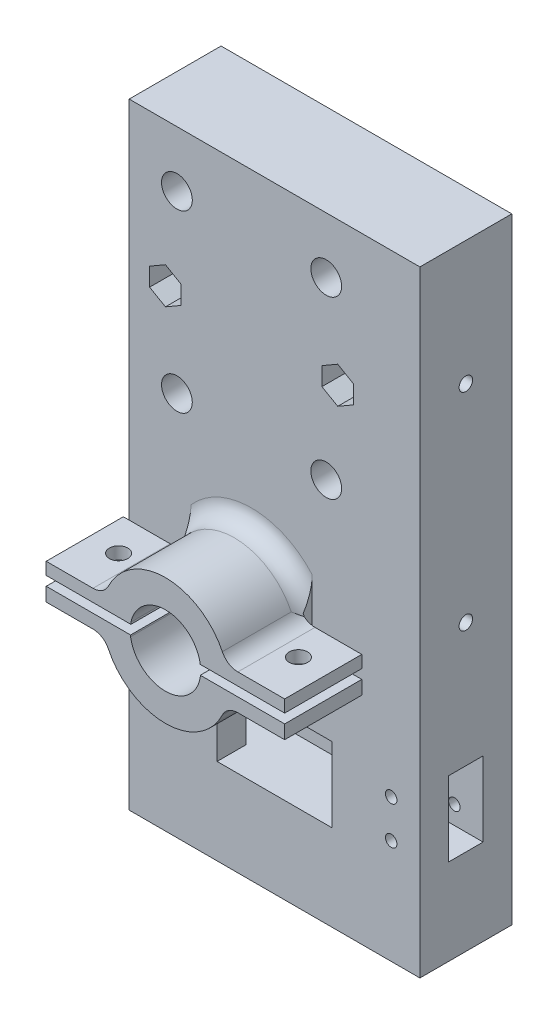
from build123d import *

# Parameters (mm, degrees)
SKETCH1_W               = 42.62295082
SKETCH1_H               = 50
SKETCH1_R               = 2.677018134
BOSS_EXTRUDE1_DEPTH     = 16
SKETCH2_R               = 11.04
CUT_EXTRUDE2_DEPTH      = 11
SKETCH3_R               = 1.75
CUT_EXTRUDE3_DEPTH      = 10
CUT_EXTRUDE6_START      = -5
CUT_EXTRUDE6_DEPTH      = 32.540101042
SKETCH30_W              = 42.62295082
SKETCH30_H              = 16
BOSS_EXTRUDE8_DEPTH     = 20.23
SKETCH10_W              = 42.62295082
SKETCH10_H              = 22
BOSS_EXTRUDE2_DEPTH     = 16
SKETCH14_W              = 6
SKETCH14_H              = 13
CUT_EXTRUDE7_DEPTH      = 82.194758677
BOSS_EXTRUDE3_DEPTH     = 8
CUT_EXTRUDE9_DEPTH      = 8
SKETCH18_W              = 0.9
SKETCH18_H              = 4
SKETCH18_W_2            = 1.8
CUT_EXTRUDE10_DEPTH     = 10.2
CUT_EXTRUDE8_DEPTH      = 76.066873458
CUT_EXTRUDE8_DEPTH_BACK = 76.066873458
SKETCH15_R              = 1
CUT_EXTRUDE5_DEPTH      = 86.979971451
CUT_EXTRUDE5_DEPTH_BACK = 50
SKETCH6_W               = 9.034037672
SKETCH6_H               = 3.85
SKETCH20_W              = 8
SKETCH20_H              = 16
BOSS_EXTRUDE5_DEPTH     = 13
SKETCH21_W              = 8
SKETCH21_H              = 6
CUT_EXTRUDE11_DEPTH     = 13
SKETCH22_R              = 1
CUT_EXTRUDE12_DEPTH     = 76.066873458
SKETCH24_W              = 50.62295082
SKETCH24_H              = 5
BOSS_EXTRUDE6_DEPTH     = 15
SKETCH25_W              = 50.62295082
SKETCH25_H              = 15
BOSS_EXTRUDE7_DEPTH     = 11
SKETCH26_R              = 1
CUT_EXTRUDE13_DEPTH     = 10
SKETCH27_W              = 4
SKETCH27_H              = 1.8
CUT_EXTRUDE14_DEPTH     = 10.2
SKETCH29_W              = 20
SKETCH29_H              = 3.2
CUT_EXTRUDE15_DEPTH     = 5
SKETCH31_W              = 9
SKETCH31_H              = 6
CUT_EXTRUDE16_DEPTH     = 11
BOSS_EXTRUDE9_DEPTH     = 15
SKETCH35_R              = 6.145
CUT_EXTRUDE17_DEPTH     = 89.752101331
SKETCH46_R              = 1.6
CUT_EXTRUDE29_DEPTH     = 116.405526257
SKETCH47_W              = 10.199129155
SKETCH47_H              = 1.570077555
CUT_EXTRUDE30_DEPTH     = 93.638736448
FILLET1_R               = 3
FILLET2_START           = 17.570077555
FILLET2_DEPTH           = 13.429922445


with BuildPart() as part:
    # Sketch1 → Boss-Extrude1 (new body)
    with BuildSketch(Plane.XY):
        Rectangle(SKETCH1_W, SKETCH1_H)
        with Locations((-13, -15.25)):
            Circle(SKETCH1_R, mode=Mode.SUBTRACT)
        with Locations(Location((13, -15.25, 0), (0, 0, 180))):
            Circle(SKETCH1_R, mode=Mode.SUBTRACT)
        with Locations((13, 15.25)):
            Circle(SKETCH1_R, mode=Mode.SUBTRACT)
        with Locations(Location((-13, 15.25, 0), (0, 0, 180))):
            Circle(SKETCH1_R, mode=Mode.SUBTRACT)
    extrude(amount=BOSS_EXTRUDE1_DEPTH)

    # Sketch2 → Cut-Extrude2 (cut)
    with BuildSketch(Plane.XY):
        Circle(SKETCH2_R)
    extrude(amount=CUT_EXTRUDE2_DEPTH, mode=Mode.SUBTRACT)

    # Sketch3 → Cut-Extrude3 (cut)
    with BuildSketch(Plane(origin=(0, 0, 0), x_dir=(-1, 0, 0), z_dir=(0, 0, -1))):
        with Locations((-15, 0)):
            Circle(SKETCH3_R)
        with Locations(Location((15, 0, 0), (0, 0, 180))):
            Circle(SKETCH3_R)
    extrude(amount=-CUT_EXTRUDE3_DEPTH, mode=Mode.SUBTRACT)

    # Sketch9 → Cut-Extrude6 (cut, through all)
    with BuildSketch(Plane(origin=(0, 0, 0), x_dir=(-1, 0, 0), z_dir=(0, 0, -1)).offset(CUT_EXTRUDE6_START)):
        Polygon((-15, 3.175426481), (-17.75, 1.58771324), (-17.75, -1.58771324), (-15, -3.175426481), (-12.25, -1.58771324), (-12.25, 1.58771324), align=None)
        Polygon((12.25, 1.58771324), (15, 3.175426481), (17.75, 1.58771324), (17.75, -1.58771324), (15, -3.175426481), (12.25, -1.58771324), align=None)
    extrude(amount=-CUT_EXTRUDE6_DEPTH, mode=Mode.SUBTRACT)

    # Sketch30 → Boss-Extrude8 (add)
    with BuildSketch(Plane.XZ.offset(25)):
        with Locations((0, 8)):
            Rectangle(SKETCH30_W, SKETCH30_H)
    extrude(amount=BOSS_EXTRUDE8_DEPTH)

    # Sketch10 → Boss-Extrude2 (add)
    with BuildSketch(Plane.XY):
        with Locations((0, -56.23)):
            Rectangle(SKETCH10_W, SKETCH10_H)
    extrude(amount=BOSS_EXTRUDE2_DEPTH)

    # Sketch14 → Cut-Extrude7 (cut, through all)
    with BuildSketch(Plane.ZY.offset(21.31147541)):
        with Locations((8, -60.73)):
            Rectangle(SKETCH14_W, SKETCH14_H)
    extrude(amount=-CUT_EXTRUDE7_DEPTH, mode=Mode.SUBTRACT)

    # Sketch16 → Boss-Extrude3 (add)
    with BuildSketch(Plane(origin=(21.31147541, 0, 0), x_dir=(0, 0, -1), z_dir=(1, 0, 0))):
        Polygon((-11, -54.23), (-8, -54.23), (-8, 25), (-16, 25), (-16, -54.23), align=None)
        Polygon((-8, 25), (-8, -54.23), (-5, -54.23), (0, -54.23), (0, 25), align=None)
    extrude(amount=BOSS_EXTRUDE3_DEPTH)

    # Sketch17 → Cut-Extrude9 (cut)
    with BuildSketch(Plane(origin=(29.31147541, 0, 0), x_dir=(0, 0, -1), z_dir=(1, 0, 0))):
        with BuildLine():
            ThreePointArc((-8, 4.56), (-9.175, 3.385), (-8, 2.21))
            Line((-8, 2.21), (-8, 4.56))
        make_face()
        with BuildLine():
            Line((-8, 4.56), (-8, 2.21))
            ThreePointArc((-8, 2.21), (-7.169149532, 2.554149532), (-6.825, 3.385))
            ThreePointArc((-6.825, 3.385), (-7.169149532, 4.215850468), (-8, 4.56))
        make_face()
        with BuildLine():
            ThreePointArc((-8, -31.44), (-9.175, -32.615), (-8, -33.79))
            Line((-8, -33.79), (-8, -31.44))
        make_face()
        with BuildLine():
            Line((-8, -31.44), (-8, -33.79))
            ThreePointArc((-8, -33.79), (-7.169149532, -33.445850468), (-6.825, -32.615))
            ThreePointArc((-6.825, -32.615), (-7.169149532, -31.784149532), (-8, -31.44))
        make_face()
    extrude(amount=-CUT_EXTRUDE9_DEPTH, mode=Mode.SUBTRACT)

    # Sketch18 → Cut-Extrude10 (cut)
    with BuildSketch(Plane(origin=(0, 0, 0), x_dir=(-1, 0, 0), z_dir=(0, 0, -1))):
        with Locations((-24.86147541, 3.385)):
            Rectangle(SKETCH18_W, SKETCH18_H)
        with Locations((-25.76147541, 3.385)):
            Rectangle(SKETCH18_W, SKETCH18_H)
        with Locations((-25.31147541, -32.615)):
            Rectangle(SKETCH18_W_2, SKETCH18_H)
    extrude(amount=-CUT_EXTRUDE10_DEPTH, mode=Mode.SUBTRACT)

    # Sketch15 → Cut-Extrude8 (cut, two sides: drawn at the far end of the back side and taken through both)
    with BuildSketch(Plane(origin=(0, 0, 0), x_dir=(-1, 0, 0), z_dir=(0, 0, -1)).offset(-CUT_EXTRUDE8_DEPTH_BACK)):
        with Locations(Location((16.31147541, -64.03, 0), (0, 0, 270))):
            Circle(SKETCH15_R)
        with Locations((16.31147541, -57.43)):
            Circle(SKETCH15_R)
    extrude(amount=CUT_EXTRUDE8_DEPTH + CUT_EXTRUDE8_DEPTH_BACK, mode=Mode.SUBTRACT)

    # Sketch6 → Cut-Extrude5 (cut, two sides: drawn at the far end of the back side and taken through both)
    with BuildSketch(Plane.XZ.offset(54.23).offset(-CUT_EXTRUDE5_DEPTH_BACK)):
        with Locations((0, 12.925)):
            Rectangle(SKETCH6_W, SKETCH6_H)
    extrude(amount=CUT_EXTRUDE5_DEPTH + CUT_EXTRUDE5_DEPTH_BACK, mode=Mode.SUBTRACT)

    # Sketch20 → Boss-Extrude5 (add)
    with BuildSketch(Plane(origin=(0, -54.23, 0), x_dir=(-1, 0, 0), z_dir=(0, -1, 0))):
        with Locations((-25.31147541, -8)):
            Rectangle(SKETCH20_W, SKETCH20_H)
    extrude(amount=BOSS_EXTRUDE5_DEPTH)

    # Sketch21 → Cut-Extrude11 (cut)
    with BuildSketch(Plane(origin=(0, -67.23, 0), x_dir=(-1, 0, 0), z_dir=(0, -1, 0))):
        with Locations((-25.31147541, -8)):
            Rectangle(SKETCH21_W, SKETCH21_H)
    extrude(amount=-CUT_EXTRUDE11_DEPTH, mode=Mode.SUBTRACT)

    # Sketch22 → Cut-Extrude12 (cut, through all)
    with BuildSketch(Plane(origin=(0, 0, 0), x_dir=(-1, 0, 0), z_dir=(0, 0, -1))):
        with Locations((-24.31147541, -64.03)):
            Circle(SKETCH22_R)
        with Locations((-24.31147541, -57.43)):
            Circle(SKETCH22_R)
    extrude(amount=-CUT_EXTRUDE12_DEPTH, mode=Mode.SUBTRACT)

    # Sketch24 → Boss-Extrude6 (add)
    with BuildSketch(Plane.XZ.offset(67.23)):
        with Locations((4, 2.5)):
            Rectangle(SKETCH24_W, SKETCH24_H)
    extrude(amount=BOSS_EXTRUDE6_DEPTH)

    # Sketch25 → Boss-Extrude7 (add)
    with BuildSketch(Plane.XY.offset(5)):
        with Locations((4, -74.73)):
            Rectangle(SKETCH25_W, SKETCH25_H)
    extrude(amount=BOSS_EXTRUDE7_DEPTH)

    # Sketch26 → Cut-Extrude13 (cut)
    with BuildSketch(Plane.XZ.offset(82.23)):
        with BuildLine():
            ThreePointArc((-15, 8), (-14, 7), (-13, 8))
            Line((-13, 8), (-15, 8))
        make_face()
        with BuildLine():
            Line((-15, 8), (-13, 8))
            ThreePointArc((-13, 8), (-14, 9), (-15, 8))
        make_face()
        with Locations(Location((22, 8, 0), (0, 0, 270))):
            Circle(SKETCH26_R)
    extrude(amount=-CUT_EXTRUDE13_DEPTH, mode=Mode.SUBTRACT)

    # Sketch27 → Cut-Extrude14 (cut)
    with BuildSketch(Plane(origin=(0, 0, 0), x_dir=(-1, 0, 0), z_dir=(0, 0, -1))):
        with Locations((-22.00147541, -78.23)):
            Rectangle(SKETCH27_W, SKETCH27_H)
        with Locations((14.00147541, -78.23)):
            Rectangle(SKETCH27_W, SKETCH27_H)
    extrude(amount=-CUT_EXTRUDE14_DEPTH, mode=Mode.SUBTRACT)

    # Sketch29 → Cut-Extrude15 (cut)
    with BuildSketch(Plane.XY.offset(16)):
        with Locations((4, -55.83)):
            Rectangle(SKETCH29_W, SKETCH29_H)
        Polygon((-6, -57.43), (-6, -59.105302663), (4, -60.73), (14, -59.105302663), (14, -57.43), align=None)
        Polygon((4, -60.73), (-6, -59.105302663), (-6, -62.354697337), align=None)
        with Locations((4, -65.63)):
            Rectangle(SKETCH29_W, SKETCH29_H)
        Polygon((14, -62.354697337), (4, -60.73), (-6, -62.354697337), (-6, -64.03), (14, -64.03), align=None)
        Polygon((14, -59.105302663), (4, -60.73), (14, -62.354697337), align=None)
    extrude(amount=-CUT_EXTRUDE15_DEPTH, mode=Mode.SUBTRACT)

    # Sketch31 → Cut-Extrude16 (cut)
    with BuildSketch(Plane(origin=(0, 0, 0), x_dir=(-1, 0, 0), z_dir=(0, 0, -1))):
        with Locations((0, 11.04)):
            Rectangle(SKETCH31_W, SKETCH31_H)
        with Locations((0, -11.04)):
            Rectangle(SKETCH31_W, SKETCH31_H)
    extrude(amount=-CUT_EXTRUDE16_DEPTH, mode=Mode.SUBTRACT)

    # Sketch32 → Boss-Extrude9 (add)
    with BuildSketch(Plane.XY.offset(16)):
        with BuildLine():
            Line((10.560909988, -36.923121675), (20.760039143, -36.923121675))
            Line((20.760039143, -36.923121675), (20.760039143, -39.06409338))
            Line((20.760039143, -39.06409338), (17.514447618, -39.06409338))
            Line((17.514447618, -39.06409338), (6.023877341, -39.06409338))
            Line((6.023877341, -39.06409338), (6.014447618, -38.74006157))
            ThreePointArc((6.014447618, -38.74006157), (0, -33.855), (-6.014447618, -38.74006157))
            Line((-6.014447618, -38.74006157), (-6.014447618, -39.06409338))
            Line((-6.014447618, -39.06409338), (-19.188118152, -39.06409338))
            Line((-19.188118152, -39.06409338), (-20.760039143, -39.06409338))
            Line((-20.760039143, -39.06409338), (-20.760039143, -36.923121675))
            Line((-20.760039143, -36.923121675), (-10.560909988, -36.923121675))
            ThreePointArc((-10.560909988, -36.923121675), (0, -29), (10.560909988, -36.923121675))
        make_face()
        with BuildLine():
            Line((-18.351282885, -40.691776253), (-6.068785984, -40.691776253))
            Line((-6.068785984, -40.691776253), (-6.068785984, -40.964811733))
            ThreePointArc((-6.068785984, -40.964811733), (0, -46.145), (6.068785984, -40.964811733))
            Line((6.068785984, -40.964811733), (6.068785984, -40.691776253))
            Line((6.068785984, -40.691776253), (18.351282885, -40.691776253))
            Line((18.351282885, -40.691776253), (20.760039143, -40.691776253))
            Line((20.760039143, -40.691776253), (20.760039143, -43.076878325))
            Line((20.760039143, -43.076878325), (10.560909988, -43.076878325))
            ThreePointArc((10.560909988, -43.076878325), (0, -51), (-10.560909988, -43.076878325))
            Line((-10.560909988, -43.076878325), (-20.760039143, -43.076878325))
            Line((-20.760039143, -43.076878325), (-20.760039143, -40.691776253))
            Line((-20.760039143, -40.691776253), (-18.351282885, -40.691776253))
        make_face()
    extrude(amount=BOSS_EXTRUDE9_DEPTH)

    # Sketch35 → Cut-Extrude17 (cut, through all)
    with BuildSketch(Plane.XY.offset(16)):
        with Locations(Location((0, -40, 0), (0, 0, 186.463801437))):
            Circle(SKETCH35_R)
    extrude(amount=-CUT_EXTRUDE17_DEPTH, mode=Mode.SUBTRACT)

    # Sketch46 → Cut-Extrude29 (cut, through all)
    with BuildSketch(Plane.XZ.offset(82.23)):
        with Locations(Location((-15.660039143, 23.5, 0), (0, 0, 270))):
            Circle(SKETCH46_R)
        with Locations(Location((15.660039143, 23.5, 0), (0, 0, 270))):
            Circle(SKETCH46_R)
    extrude(amount=-CUT_EXTRUDE29_DEPTH, mode=Mode.SUBTRACT)

    # Sketch47 → Cut-Extrude30 (cut, through all)
    with BuildSketch(Plane(origin=(0, 0, 0), x_dir=(1, 0, 0), z_dir=(0, 1, 0))):
        with Locations((-15.660474565, -16.785038777)):
            Rectangle(SKETCH47_W, SKETCH47_H)
        with Locations((15.660474565, -16.785038777)):
            Rectangle(SKETCH47_W, SKETCH47_H)
    extrude(amount=-CUT_EXTRUDE30_DEPTH, mode=Mode.SUBTRACT)

    # Fillet1
    # the kernel refuses this fillet: 3 mm, written as the material it adds along each edge
    with BuildSketch(Plane(origin=(0, -40, 16), x_dir=(0.9214282650932413, 0.3885485198623971, 0), z_dir=(-0.3885485198623971, 0.9214282650932413, 0))) as fillet1_piece_1_section:
        with BuildLine():
            CenterArc((11 + FILLET1_R, -FILLET1_R), FILLET1_R, 90, 90)
            Line((11, -FILLET1_R), (11, 0))
            Line((11, 0), (11 + FILLET1_R, 0))
        make_face()
    fillet1_piece_1 = revolve(axis=Axis((0, -40, 16), (0, 0, -1)), revolution_arc=225.72842835, mode=Mode.PRIVATE)
    fillet1_piece_1 = split(fillet1_piece_1, bisect_by=Plane(origin=(-10.560909988, -40, 16), z_dir=(1, 0, 0)), keep=Keep.TOP, mode=Mode.PRIVATE)
    fillet1_piece_1 = split(fillet1_piece_1, bisect_by=Plane(origin=(10.560909988, -40, 16), z_dir=(-1, 0, 0)), keep=Keep.TOP, mode=Mode.PRIVATE)
    add(fillet1_piece_1)
    with BuildSketch(Plane(origin=(0, -40, 16), x_dir=(0.9214282650932413, 0.3885485198623971, 0), z_dir=(-0.3885485198623971, 0.9214282650932413, 0))) as fillet1_piece_2_section:
        with BuildLine():
            CenterArc((11 + FILLET1_R, -FILLET1_R), FILLET1_R, 90, 90)
            Line((11, -FILLET1_R), (11, 0))
            Line((11, 0), (11 + FILLET1_R, 0))
        make_face()
    fillet1_piece_2 = revolve(axis=Axis((0, -40, 16), (0, 0, -1)), revolution_arc=225.72842835, mode=Mode.PRIVATE)
    fillet1_piece_2 = split(fillet1_piece_2, bisect_by=Plane(origin=(0, -40, 17.570077555), z_dir=(0, 0, 1)), keep=Keep.TOP, mode=Mode.PRIVATE)
    fillet1_piece_2 = split(fillet1_piece_2, bisect_by=Plane(origin=(0, -39.06409338, 16), z_dir=(0, 1, 0)), keep=Keep.TOP, mode=Mode.PRIVATE)
    add(fillet1_piece_2)
    with BuildSketch(Plane(origin=(0, -40, 16), x_dir=(0.9214282650932413, 0.3885485198623971, 0), z_dir=(-0.3885485198623971, 0.9214282650932413, 0))) as fillet1_piece_3_section:
        with BuildLine():
            CenterArc((11 + FILLET1_R, -FILLET1_R), FILLET1_R, 90, 90)
            Line((11, -FILLET1_R), (11, 0))
            Line((11, 0), (11 + FILLET1_R, 0))
        make_face()
    fillet1_piece_3 = revolve(axis=Axis((0, -40, 16), (0, 0, -1)), revolution_arc=225.72842835, mode=Mode.PRIVATE)
    fillet1_piece_3 = split(fillet1_piece_3, bisect_by=Plane(origin=(0, -40, 17.570077555), z_dir=(0, 0, 1)), keep=Keep.TOP, mode=Mode.PRIVATE)
    fillet1_piece_3 = split(fillet1_piece_3, bisect_by=Plane(origin=(0, -43.076878325, 16), z_dir=(0, -1, 0)), keep=Keep.TOP, mode=Mode.PRIVATE)
    add(fillet1_piece_3)
    with BuildSketch(Plane(origin=(0, -40, 16), x_dir=(-0.9214282650932415, -0.3885485198623964, 0), z_dir=(0.3885485198623964, -0.9214282650932415, 0))) as fillet1_piece_4_section:
        with BuildLine():
            CenterArc((11 + FILLET1_R, -FILLET1_R), FILLET1_R, 90, 90)
            Line((11, -FILLET1_R), (11, 0))
            Line((11, 0), (11 + FILLET1_R, 0))
        make_face()
    fillet1_piece_4 = revolve(axis=Axis((0, -40, 16), (0, 0, -1)), revolution_arc=225.72842835, mode=Mode.PRIVATE)
    fillet1_piece_4 = split(fillet1_piece_4, bisect_by=Plane(origin=(-10.560909988, -40, 16), z_dir=(1, 0, 0)), keep=Keep.TOP, mode=Mode.PRIVATE)
    fillet1_piece_4 = split(fillet1_piece_4, bisect_by=Plane(origin=(10.560909988, -40, 16), z_dir=(-1, 0, 0)), keep=Keep.TOP, mode=Mode.PRIVATE)
    add(fillet1_piece_4)
    with BuildSketch(Plane(origin=(0, -40, 16), x_dir=(-0.9214282650932415, -0.3885485198623964, 0), z_dir=(0.3885485198623964, -0.9214282650932415, 0))) as fillet1_piece_5_section:
        with BuildLine():
            CenterArc((11 + FILLET1_R, -FILLET1_R), FILLET1_R, 90, 90)
            Line((11, -FILLET1_R), (11, 0))
            Line((11, 0), (11 + FILLET1_R, 0))
        make_face()
    fillet1_piece_5 = revolve(axis=Axis((0, -40, 16), (0, 0, -1)), revolution_arc=225.72842835, mode=Mode.PRIVATE)
    fillet1_piece_5 = split(fillet1_piece_5, bisect_by=Plane(origin=(0, -40, 17.570077555), z_dir=(0, 0, 1)), keep=Keep.TOP, mode=Mode.PRIVATE)
    fillet1_piece_5 = split(fillet1_piece_5, bisect_by=Plane(origin=(0, -43.076878325, 16), z_dir=(0, -1, 0)), keep=Keep.TOP, mode=Mode.PRIVATE)
    add(fillet1_piece_5)
    with BuildSketch(Plane(origin=(0, -40, 16), x_dir=(-0.9214282650932415, -0.3885485198623964, 0), z_dir=(0.3885485198623964, -0.9214282650932415, 0))) as fillet1_piece_6_section:
        with BuildLine():
            CenterArc((11 + FILLET1_R, -FILLET1_R), FILLET1_R, 90, 90)
            Line((11, -FILLET1_R), (11, 0))
            Line((11, 0), (11 + FILLET1_R, 0))
        make_face()
    fillet1_piece_6 = revolve(axis=Axis((0, -40, 16), (0, 0, -1)), revolution_arc=225.72842835, mode=Mode.PRIVATE)
    fillet1_piece_6 = split(fillet1_piece_6, bisect_by=Plane(origin=(0, -40, 17.570077555), z_dir=(0, 0, 1)), keep=Keep.TOP, mode=Mode.PRIVATE)
    fillet1_piece_6 = split(fillet1_piece_6, bisect_by=Plane(origin=(0, -39.06409338, 16), z_dir=(0, 1, 0)), keep=Keep.TOP, mode=Mode.PRIVATE)
    add(fillet1_piece_6)

    # Fillet2: read off the stored shape, not the designer's step
    # Fillet2 outline → Fillet2 (add)
    with BuildSketch(Plane.XY.offset(FILLET2_START)):
        with BuildLine():
            Line((-10.560909988, -43.076878325), (-12.612357029, -43.076878325))
            ThreePointArc((-12.612357029, -43.076878325), (-11.016513151, -43.536547182), (-9.909709094, -44.774690113))
            ThreePointArc((-9.909709094, -44.774690113), (-10.270452892, -43.939263559), (-10.560909988, -43.076878325))
        make_face()
        with BuildLine():
            ThreePointArc((10.560909988, -43.076878325), (10.270452892, -43.939263559), (9.909709094, -44.774690113))
            ThreePointArc((9.909709094, -44.774690113), (11.016513151, -43.536547182), (12.612357029, -43.076878325))
            Line((12.612357029, -43.076878325), (10.560909988, -43.076878325))
        make_face()
        with BuildLine():
            ThreePointArc((-10.560909988, -36.923121675), (-10.270452892, -36.060736441), (-9.909709094, -35.225309887))
            ThreePointArc((-9.909709094, -35.225309887), (-11.016513151, -36.463452818), (-12.612357029, -36.923121675))
            Line((-12.612357029, -36.923121675), (-10.560909988, -36.923121675))
        make_face()
        with BuildLine():
            ThreePointArc((12.612357029, -36.923121675), (11.016513151, -36.463452818), (9.909709094, -35.225309887))
            ThreePointArc((9.909709094, -35.225309887), (10.270452892, -36.060736441), (10.560909988, -36.923121675))
            Line((10.560909988, -36.923121675), (12.612357029, -36.923121675))
        make_face()
    extrude(amount=FILLET2_DEPTH)


solid = part.part
